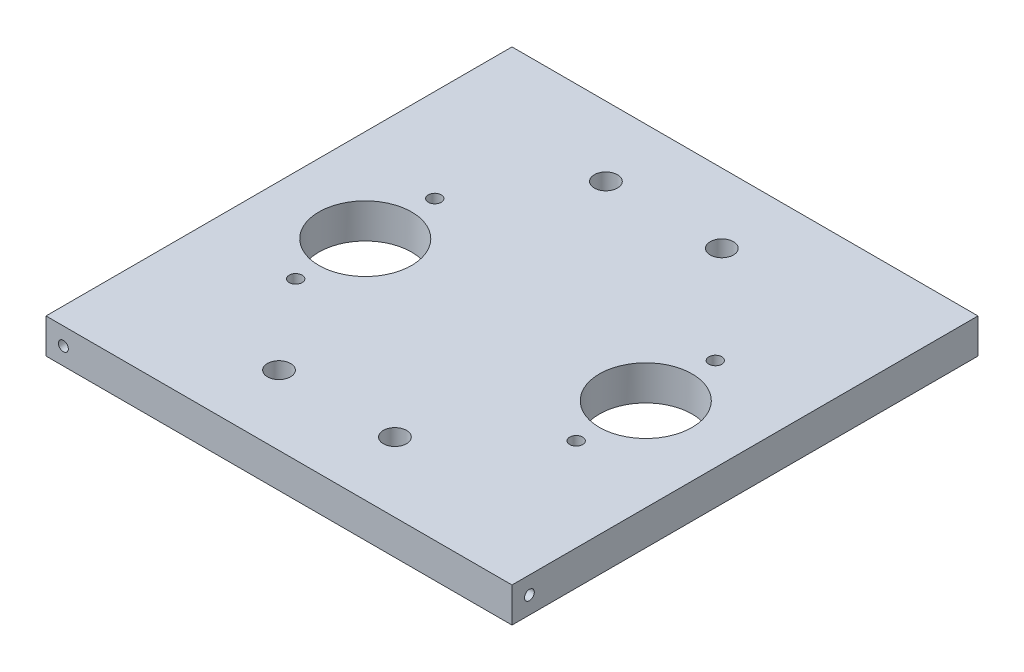
from build123d import *

# Parameters (mm, degrees)
SKETCH1_W                      = 127.635
SKETCH1_H                      = 127.635
MAIN_PLATE_DEPTH               = 9.525
SKETCH2_R                      = 3.175
U_BOLT_HOLE_DEPTH              = 12.7
U_BOLT_PATTERN_COUNT           = 2
U_BOLT_PATTERN_PITCH           = 31.75
U_BOLT_PATTERN_COUNT_DIR2      = 2
U_BOLT_PATTERN_PITCH_DIR2      = 89.535
SKETCH3_R                      = 1.778
RAPTOR_BOLT_HOLE_DEPTH         = 12.7
RAPTOR_BOLT_PATTERN_COUNT      = 2
RAPTOR_BOLT_PATTERN_PITCH      = 38.1
RAPTOR_BOLT_PATTERN_COUNT_DIR2 = 2
RAPTOR_BOLT_PATTERN_PITCH_DIR2 = 76.835
SKETCH4_R                      = 12.7
CO2_CYLINDER_HOLE_DEPTH        = 12.7
CO2_PATTERN_COUNT              = 2
CO2_PATTERN_PITCH              = 76.835
SKETCH5_R                      = 1.35255
FRAME_ATTACHMENT_HOLE_1_DEPTH  = 12.7
SKETCH6_R                      = 1.35255
FRAME_ATTACHMENT_HOLE_2_DEPTH  = 12.7
SKETCH7_R                      = 1.35255
FRAME_ATTACHMENT_HOLE_3_DEPTH  = 12.7
SKETCH8_R                      = 1.35255
FRAME_ATTACHMENT_HOLE_4_DEPTH  = 12.7


with BuildPart() as part:
    # Sketch1 → Main Plate (new body)
    with BuildSketch(Plane(origin=(0, 0, 0), x_dir=(1, 0, 0), z_dir=(0, 1, 0))):
        with Locations((63.8175, 63.8175)):
            Rectangle(SKETCH1_W, SKETCH1_H)
    extrude(amount=MAIN_PLATE_DEPTH)

    # Sketch2 → U-Bolt Hole (cut)
    with BuildSketch(Plane(origin=(0, 9.525, 0), x_dir=(1, 0, 0), z_dir=(0, 1, 0))):
        with Locations((44.7675, 108.585)):
            Circle(SKETCH2_R)
    u_bolt_hole = extrude(amount=-U_BOLT_HOLE_DEPTH, mode=Mode.SUBTRACT)

    # U-Bolt Pattern: U-Bolt Hole 2 × 2
    with Locations(*[(i * U_BOLT_PATTERN_PITCH, 0, j * U_BOLT_PATTERN_PITCH_DIR2) for i in range(U_BOLT_PATTERN_COUNT) for j in range(U_BOLT_PATTERN_COUNT_DIR2) if (i, j) != (0, 0)]):
        add(u_bolt_hole, mode=Mode.SUBTRACT)

    # Sketch3 → Raptor Bolt Hole (cut)
    with BuildSketch(Plane(origin=(0, 9.525, 0), x_dir=(1, 0, 0), z_dir=(0, 1, 0))):
        with Locations((25.4, 42.9895)):
            Circle(SKETCH3_R)
    raptor_bolt_hole = extrude(amount=-RAPTOR_BOLT_HOLE_DEPTH, mode=Mode.SUBTRACT)

    # Raptor Bolt Pattern: Raptor Bolt Hole 2 × 2
    with Locations(*[(j * RAPTOR_BOLT_PATTERN_PITCH_DIR2, 0, -i * RAPTOR_BOLT_PATTERN_PITCH) for i in range(RAPTOR_BOLT_PATTERN_COUNT) for j in range(RAPTOR_BOLT_PATTERN_COUNT_DIR2) if (i, j) != (0, 0)]):
        add(raptor_bolt_hole, mode=Mode.SUBTRACT)

    # Sketch4 → Co2 Cylinder Hole (cut)
    with BuildSketch(Plane(origin=(0, 9.525, 0), x_dir=(1, 0, 0), z_dir=(0, 1, 0))):
        with Locations((25.4, 62.0395)):
            Circle(SKETCH4_R)
    co2_cylinder_hole = extrude(amount=-CO2_CYLINDER_HOLE_DEPTH, mode=Mode.SUBTRACT)

    # Co2 Pattern: Co2 Cylinder Hole ×2
    with Locations(*[(i * CO2_PATTERN_PITCH, 0, 0) for i in range(1, CO2_PATTERN_COUNT)]):
        add(co2_cylinder_hole, mode=Mode.SUBTRACT)

    # Sketch5 → Frame attachment hole 1 (cut)
    with BuildSketch(Plane.XY):
        with Locations((4.7625, 4.7625)):
            Circle(SKETCH5_R)
    extrude(amount=-FRAME_ATTACHMENT_HOLE_1_DEPTH, mode=Mode.SUBTRACT)

    # Sketch6 → Frame attachment hole 2 (cut)
    with BuildSketch(Plane.ZY):
        with Locations((-122.8725, 4.7625)):
            Circle(SKETCH6_R)
    extrude(amount=-FRAME_ATTACHMENT_HOLE_2_DEPTH, mode=Mode.SUBTRACT)

    # Sketch7 → Frame attachment hole 3 (cut)
    with BuildSketch(Plane(origin=(0, 0, -127.635), x_dir=(-1, 0, 0), z_dir=(0, 0, -1))):
        with Locations((-122.8725, 4.7625)):
            Circle(SKETCH7_R)
    extrude(amount=-FRAME_ATTACHMENT_HOLE_3_DEPTH, mode=Mode.SUBTRACT)

    # Sketch8 → Frame attachment hole 4 (cut)
    with BuildSketch(Plane(origin=(127.635, 0, 0), x_dir=(0, 0, -1), z_dir=(1, 0, 0))):
        with Locations((4.7625, 4.7625)):
            Circle(SKETCH8_R)
    extrude(amount=-FRAME_ATTACHMENT_HOLE_4_DEPTH, mode=Mode.SUBTRACT)


solid = part.part
